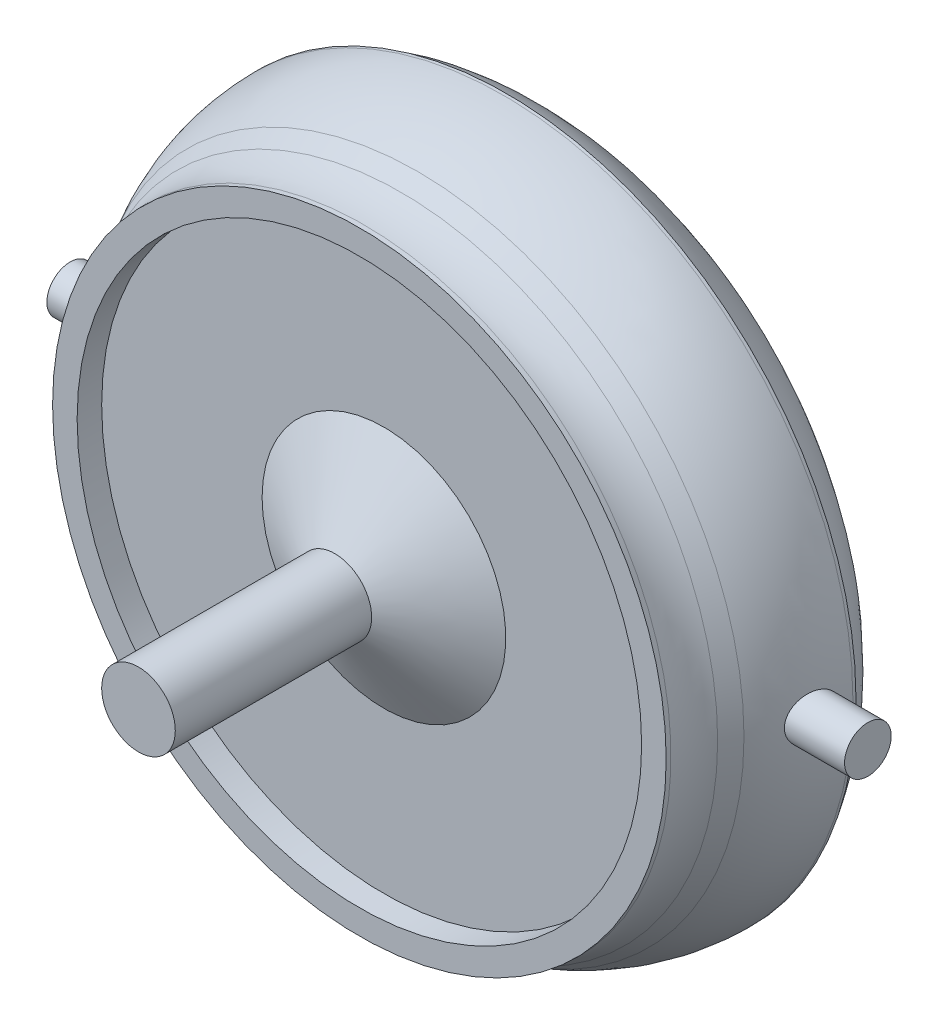
from build123d import *

# Parameters (mm, degrees)
SKETCH1_R                = 15
BOSS_EXTRUDE1_DEPTH      = 80
SKETCH2_R                = 15
BOSS_EXTRUDE2_DEPTH      = 20
BOSS_EXTRUDE2_DRAFT      = -60
SKETCH3_R                = 125
BOSS_EXTRUDE5_DEPTH      = 30
BOSS_EXTRUDE5_DRAFT      = -30
SKETCH6_R                = 125
SKETCH6_R_2              = 115
BOSS_EXTRUDE6_DEPTH      = 10
SKETCH7_R                = 142.320508076
BOSS_EXTRUDE7_DEPTH      = 20
SKETCH9_R                = 142.320508076
BOSS_EXTRUDE8_DEPTH      = 30
BOSS_EXTRUDE8_TAPER      = 30
FILLET1_R                = 60
FILLET3_R                = 70
FILLET4_R                = 30
BOSS_EXTRUDE9_DEPTH      = 20
BOSS_EXTRUDE9_DEPTH_BACK = 305
SKETCH10_R               = 9.5


with BuildPart() as part:
    # Sketch1 → Boss-Extrude1 (new body)
    with BuildSketch(Plane.XY):
        Circle(SKETCH1_R)
    extrude(amount=BOSS_EXTRUDE1_DEPTH)


with BuildPart() as boss_extrude2_tool:
    # Sketch2 → Boss-Extrude2 (with draft: the straight prism first)
    with BuildSketch(Plane(origin=(0, 0, 0), x_dir=(-1, 0, 0), z_dir=(0, 0, -1))):
        Circle(SKETCH2_R)
    extrude(amount=BOSS_EXTRUDE2_DEPTH)
    # Boss-Extrude2: the draft: its side faces are tilted about the plane it starts from
    boss_extrude2_sides = [boss_extrude2_tool.faces().sort_by_distance(p)[0] for p in [
        (15, 0, -10),
    ]]
    draft(boss_extrude2_sides, Plane(origin=(0, 0, 0), x_dir=(-1, 0, 0), z_dir=(0, 0, -1)), BOSS_EXTRUDE2_DRAFT)


with BuildPart() as part_1:
    add(part.part)

    # Boss-Extrude2: add boss_extrude2_tool
    add(boss_extrude2_tool.part)


with BuildPart() as boss_extrude5_tool:
    # Sketch3 → Boss-Extrude5 (with draft: the straight prism first)
    with BuildSketch(Plane(origin=(0, 0, -20), x_dir=(-1, 0, 0), z_dir=(0, 0, -1))):
        Circle(SKETCH3_R)
    extrude(amount=BOSS_EXTRUDE5_DEPTH)
    # Boss-Extrude5: the draft: its side faces are tilted about the plane it starts from
    boss_extrude5_sides = [boss_extrude5_tool.faces().sort_by_distance(p)[0] for p in [
        (125, 0, -35),
    ]]
    draft(boss_extrude5_sides, Plane(origin=(0, 0, -20), x_dir=(-1, 0, 0), z_dir=(0, 0, -1)), BOSS_EXTRUDE5_DRAFT)


with BuildPart() as part_2:
    add(part_1.part)

    # Boss-Extrude5: add boss_extrude5_tool
    add(boss_extrude5_tool.part)

    # Sketch6 → Boss-Extrude6 (add)
    with BuildSketch(Plane.XY.offset(-20)):
        Circle(SKETCH6_R)
        Circle(SKETCH6_R_2, mode=Mode.SUBTRACT)
    extrude(amount=BOSS_EXTRUDE6_DEPTH)

    # Sketch7 → Boss-Extrude7 (add)
    with BuildSketch(Plane(origin=(0, 0, -50), x_dir=(-1, 0, 0), z_dir=(0, 0, -1))):
        Circle(SKETCH7_R)
    extrude(amount=BOSS_EXTRUDE7_DEPTH)

    # Sketch9 → Boss-Extrude8 (add)
    with BuildSketch(Plane(origin=(0, 0, -70), x_dir=(-1, 0, 0), z_dir=(0, 0, -1))):
        Circle(SKETCH9_R)
    extrude(amount=BOSS_EXTRUDE8_DEPTH, taper=BOSS_EXTRUDE8_TAPER)

    # Fillet1
    fillet1_edges = [part_2.edges().sort_by_distance(p)[0] for p in [
        (125, 0, -100),
    ]]
    fillet(fillet1_edges, radius=FILLET1_R - 0.0001)  # a hair under: the kernel refuses the full size

    # Fillet3
    fillet3_edges = [part_2.edges().sort_by_distance(p)[0] for p in [
        (142.320508076, 0, -50),
    ]]
    fillet(fillet3_edges, radius=FILLET3_R)

    # Fillet4
    fillet4_edges = [part_2.edges().sort_by_distance(p)[0] for p in [
        (0, -125, -20),
    ]]
    fillet(fillet4_edges, radius=FILLET4_R)

    # Sketch10 → Boss-Extrude9 (add, two sides: drawn at the far end of the back side and taken through both)
    with BuildSketch(Plane.ZY.offset(142.320508076).offset(-BOSS_EXTRUDE9_DEPTH_BACK)):
        with Locations((-54.490163429, 0)):
            Circle(SKETCH10_R)
    extrude(amount=BOSS_EXTRUDE9_DEPTH + BOSS_EXTRUDE9_DEPTH_BACK)


solid = part_2.part
